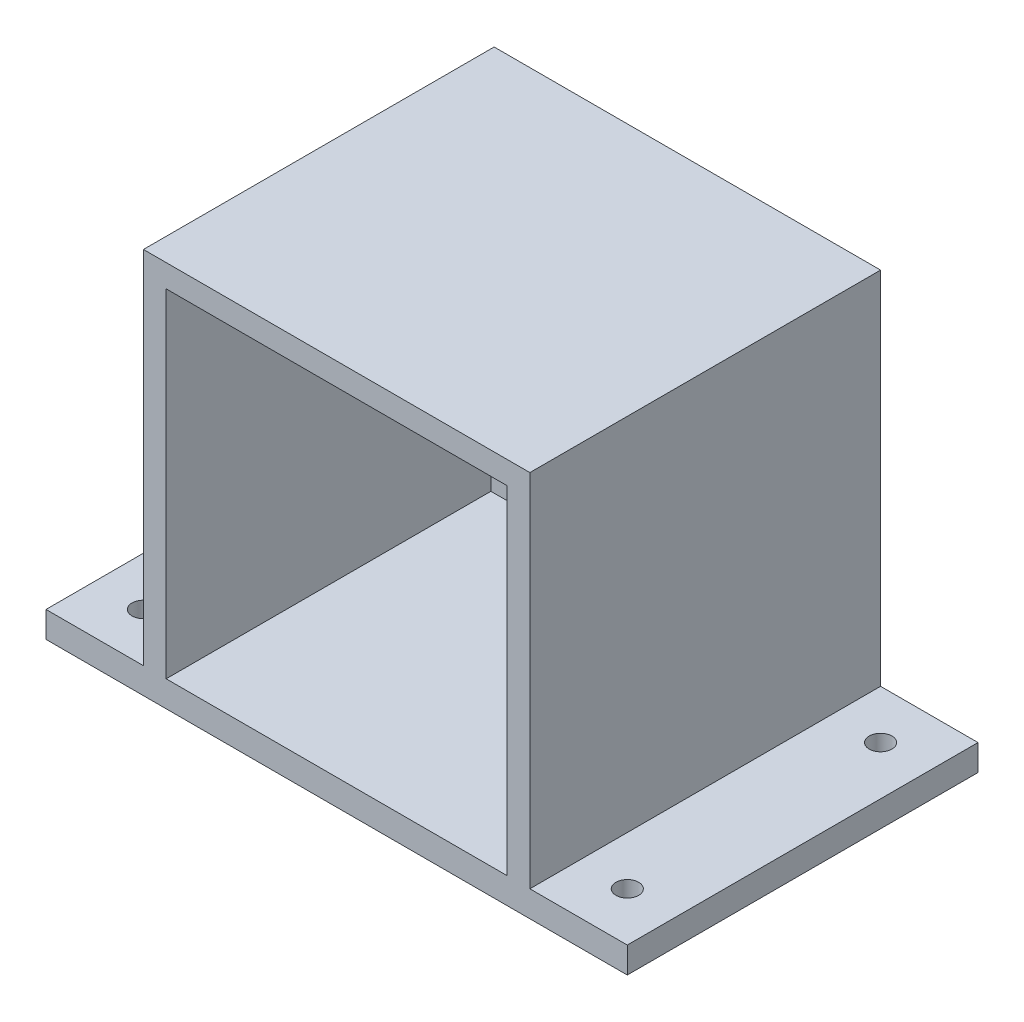
from build123d import *

# Parameters (mm, degrees)
SKETCH5_W           = 59.5
SKETCH5_H           = 59.5
SKETCH5_W_2         = 52.5
SKETCH5_H_2         = 52.5
BOSS_EXTRUDE5_DEPTH = 54
SKETCH6_W           = 59.5
SKETCH6_H           = 59.5
BOSS_EXTRUDE6_DEPTH = 4
SKETCH7_R           = 1.75
BOSS_EXTRUDE7_DEPTH = 4


with BuildPart() as part:
    # Sketch5 → Boss-Extrude5 (new body)
    with BuildSketch(Plane.XY):
        with Locations((26.25, 26.25)):
            Rectangle(SKETCH5_W, SKETCH5_H)
        with Locations((26.25, 26.25)):
            Rectangle(SKETCH5_W_2, SKETCH5_H_2, mode=Mode.SUBTRACT)
    extrude(amount=BOSS_EXTRUDE5_DEPTH)

    # Sketch6 → Boss-Extrude6 (add)
    with BuildSketch(Plane(origin=(0, 0, 0), x_dir=(-1, 0, 0), z_dir=(0, 0, -1))):
        with Locations((-26.25, 26.25)):
            Rectangle(SKETCH6_W, SKETCH6_H)
    extrude(amount=-BOSS_EXTRUDE6_DEPTH)

    # Sketch7 → Boss-Extrude7 (add)
    with BuildSketch(Plane.XZ.offset(3.5)):
        Polygon((-3.5, 54), (-18.5, 54), (-18.5, 0), (71, 0), (71, 54), (56, 54), align=None)
        with Locations((-11, 46.5)):
            Circle(SKETCH7_R, mode=Mode.SUBTRACT)
        with Locations((-11, 7.5)):
            Circle(SKETCH7_R, mode=Mode.SUBTRACT)
        with Locations((63.5, 7.5)):
            Circle(SKETCH7_R, mode=Mode.SUBTRACT)
        with Locations((63.5, 46.5)):
            Circle(SKETCH7_R, mode=Mode.SUBTRACT)
    extrude(amount=-BOSS_EXTRUDE7_DEPTH)


solid = part.part
